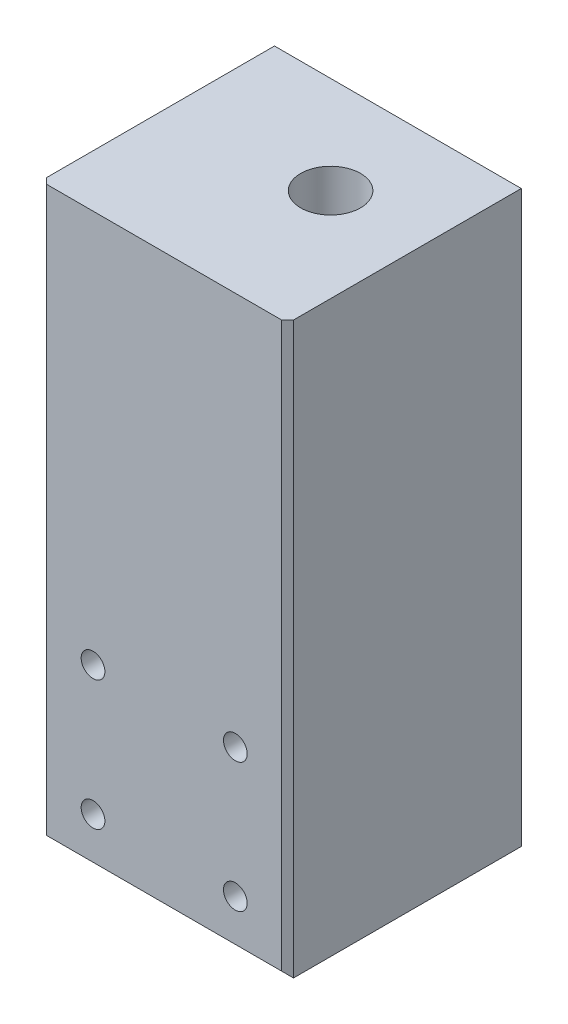
from build123d import *

# Parameters (mm, degrees)
PRIMARY_START           = -25.4
SKETCH2_W               = 66
SKETCH2_H               = 60
SKETCH2_R               = 1.5875
SKETCH2_H_2             = 92.4
PRIMARY_EXTRUSION_DEPTH = 62.5
CUT_EXTRUDE2_START      = -25.4
SKETCH3_R               = 3.175
CUT_EXTRUDE2_DEPTH      = 25.4
CUT_EXTRUDE3_START      = -87.9
SKETCH2_4_R             = 1.5875
CUT_EXTRUDE3_DEPTH      = 6.35
CHAMFER1_SIZE           = 1.5875
CUT_EXTRUDE4_DEPTH      = 6.35
CUT_EXTRUDE5_OUTLINE_R  = 8
CUT_EXTRUDE5_DEPTH      = 152.4


# Read off the part's stored shape, not the designer's step: Cut-Extrude5
with BuildPart() as part:
    # Sketch2 → Primary Extrusion (new body)
    # profile 1 of 10: a face of its own
    with BuildSketch(Plane.XY.offset(PRIMARY_START)):
        with Locations((112.625, 30)):
            Rectangle(SKETCH2_W, SKETCH2_H)
        with BuildLine():
            ThreePointArc((88.925, 7), (85.625, 3.7), (82.325, 7))
            ThreePointArc((82.325, 7), (85.625, 10.3), (88.925, 7))
        make_face(mode=Mode.SUBTRACT)
        with BuildLine():
            ThreePointArc((95.325, 7), (98.625, 10.3), (101.925, 7))
            ThreePointArc((101.925, 7), (98.625, 3.7), (95.325, 7))
        make_face(mode=Mode.SUBTRACT)
        with Locations((113.875, 23.675)):
            Circle(SKETCH2_R, mode=Mode.SUBTRACT)
        with Locations((139.275, 23.675)):
            Circle(SKETCH2_R, mode=Mode.SUBTRACT)
        with Locations((113.875, 36.325)):
            Circle(SKETCH2_R, mode=Mode.SUBTRACT)
        with Locations((139.275, 36.325)):
            Circle(SKETCH2_R, mode=Mode.SUBTRACT)
        with BuildLine():
            ThreePointArc((88.925, 53), (85.625, 49.7), (82.325, 53))
            ThreePointArc((82.325, 53), (85.625, 56.3), (88.925, 53))
        make_face(mode=Mode.SUBTRACT)
        with BuildLine():
            ThreePointArc((101.925, 53), (98.625, 49.7), (95.325, 53))
            ThreePointArc((95.325, 53), (98.625, 56.3), (101.925, 53))
        make_face(mode=Mode.SUBTRACT)
    # profile 2 of 10: a face of its own
    with BuildSketch(Plane.XY.offset(PRIMARY_START)):
        with BuildLine():
            ThreePointArc((82.325, 53), (85.625, 49.7), (88.925, 53))
            ThreePointArc((88.925, 53), (85.625, 56.3), (82.325, 53))
        make_face()
    # profile 3 of 10: a face of its own
    with BuildSketch(Plane.XY.offset(PRIMARY_START)):
        with BuildLine():
            ThreePointArc((95.325, 53), (98.625, 49.7), (101.925, 53))
            ThreePointArc((101.925, 53), (98.625, 56.3), (95.325, 53))
        make_face()
    # profile 4 of 10: a face of its own
    with BuildSketch(Plane.XY.offset(PRIMARY_START)):
        with Locations((113.875, 36.325)):
            Circle(SKETCH2_R)
    # profile 5 of 10: a face of its own
    with BuildSketch(Plane.XY.offset(PRIMARY_START)):
        with Locations((113.875, 23.675)):
            Circle(SKETCH2_R)
    # profile 6 of 10: a face of its own
    with BuildSketch(Plane.XY.offset(PRIMARY_START)):
        with Locations((139.275, 36.325)):
            Circle(SKETCH2_R)
    # profile 7 of 10: a face of its own
    with BuildSketch(Plane.XY.offset(PRIMARY_START)):
        with Locations((139.275, 23.675)):
            Circle(SKETCH2_R)
    # profile 8 of 10: a face of its own
    with BuildSketch(Plane.XY.offset(PRIMARY_START)):
        with BuildLine():
            ThreePointArc((82.325, 7), (85.625, 3.7), (88.925, 7))
            ThreePointArc((88.925, 7), (85.625, 10.3), (82.325, 7))
        make_face()
    # profile 9 of 10: a face of its own
    with BuildSketch(Plane.XY.offset(PRIMARY_START)):
        with BuildLine():
            ThreePointArc((101.925, 7), (98.625, 10.3), (95.325, 7))
            ThreePointArc((95.325, 7), (98.625, 3.7), (101.925, 7))
        make_face()
    # profile 10 of 10: a face of its own
    with BuildSketch(Plane.XY.offset(PRIMARY_START)):
        with Locations((112.625, 106.2)):
            Rectangle(SKETCH2_W, SKETCH2_H_2)
    extrude(amount=-PRIMARY_EXTRUSION_DEPTH)

    # Sketch3 → Cut-Extrude2 (cut)
    with BuildSketch(Plane.XY.offset(CUT_EXTRUDE2_START)):
        with Locations((-135.5, 47.3)):
            Circle(SKETCH3_R)
        with Locations((-135.5, 12.7)):
            Circle(SKETCH3_R)
        with Locations((93.595, 47.3)):
            Circle(SKETCH3_R)
        with Locations((131.655, 47.3)):
            Circle(SKETCH3_R)
        with Locations((131.655, 12.7)):
            Circle(SKETCH3_R)
        with Locations((93.595, 12.7)):
            Circle(SKETCH3_R)
    extrude(amount=-CUT_EXTRUDE2_DEPTH, mode=Mode.SUBTRACT)

    # Sketch2<4> → Cut-Extrude3 (cut)
    with BuildSketch(Plane.XY.offset(CUT_EXTRUDE3_START)):
        with BuildLine():
            ThreePointArc((95.325, 53), (98.625, 49.7), (101.925, 53))
            ThreePointArc((101.925, 53), (98.625, 56.3), (95.325, 53))
        make_face()
        with BuildLine():
            ThreePointArc((82.325, 53), (85.625, 49.7), (88.925, 53))
            ThreePointArc((88.925, 53), (85.625, 56.3), (82.325, 53))
        make_face()
        with BuildLine():
            ThreePointArc((101.925, 7), (98.625, 10.3), (95.325, 7))
            ThreePointArc((95.325, 7), (98.625, 3.7), (101.925, 7))
        make_face()
        with BuildLine():
            ThreePointArc((82.325, 7), (85.625, 3.7), (88.925, 7))
            ThreePointArc((88.925, 7), (85.625, 10.3), (82.325, 7))
        make_face()
        with Locations((139.275, 36.325)):
            Circle(SKETCH2_4_R)
        with Locations((113.875, 36.325)):
            Circle(SKETCH2_4_R)
        with Locations((113.875, 23.675)):
            Circle(SKETCH2_4_R)
        with Locations((139.275, 23.675)):
            Circle(SKETCH2_4_R)
    extrude(amount=CUT_EXTRUDE3_DEPTH, mode=Mode.SUBTRACT)

    # Chamfer1
    chamfer1_edges = [part.edges().sort_by_distance(p)[0] for p in [
        (112.625, 0, -25.4),
        (79.625, 76.2, -25.4),
        (145.625, 76.2, -25.4),
    ]]
    chamfer(chamfer1_edges, length=CHAMFER1_SIZE)

    # Sketch4 → Cut-Extrude4 (cut)
    with BuildSketch(Plane(origin=(0, 0, 0), x_dir=(1, 0, 0), z_dir=(0, 1, 0))):
        with BuildLine():
            ThreePointArc((131.310028843, 75.335028843), (134.060028843, 78.085028843), (136.810028843, 75.335028843))
            ThreePointArc((136.810028843, 75.335028843), (134.060028843, 72.585028843), (131.310028843, 75.335028843))
        make_face()
        with BuildLine():
            ThreePointArc((117.875, 80.9), (120.625, 83.65), (123.375, 80.9))
            ThreePointArc((123.375, 80.9), (120.625, 78.15), (117.875, 80.9))
        make_face()
        with BuildLine():
            ThreePointArc((104.439971157, 75.335028843), (107.189971157, 78.085028843), (109.939971157, 75.335028843))
            ThreePointArc((109.939971157, 75.335028843), (107.189971157, 72.585028843), (104.439971157, 75.335028843))
        make_face()
        with BuildLine():
            ThreePointArc((104.439971157, 48.464971157), (107.189971157, 51.214971157), (109.939971157, 48.464971157))
            ThreePointArc((109.939971157, 48.464971157), (107.189971157, 45.714971157), (104.439971157, 48.464971157))
        make_face()
        with BuildLine():
            ThreePointArc((123.375, 42.9), (120.625, 40.15), (117.875, 42.9))
            ThreePointArc((117.875, 42.9), (120.625, 45.65), (123.375, 42.9))
        make_face()
        with BuildLine():
            ThreePointArc((136.810028843, 48.464971157), (134.060028843, 45.714971157), (131.310028843, 48.464971157))
            ThreePointArc((131.310028843, 48.464971157), (134.060028843, 51.214971157), (136.810028843, 48.464971157))
        make_face()
    extrude(amount=CUT_EXTRUDE4_DEPTH, mode=Mode.SUBTRACT)

    # Cut-Extrude5 outline → Cut-Extrude5 (cut)
    with BuildSketch(Plane(origin=(0, 0, 0), x_dir=(1, 0, 0), z_dir=(0, 1, 0))):
        with Locations((120.625, 61.9)):
            Circle(CUT_EXTRUDE5_OUTLINE_R)
    extrude(amount=CUT_EXTRUDE5_DEPTH, mode=Mode.SUBTRACT)


solid = part.part
